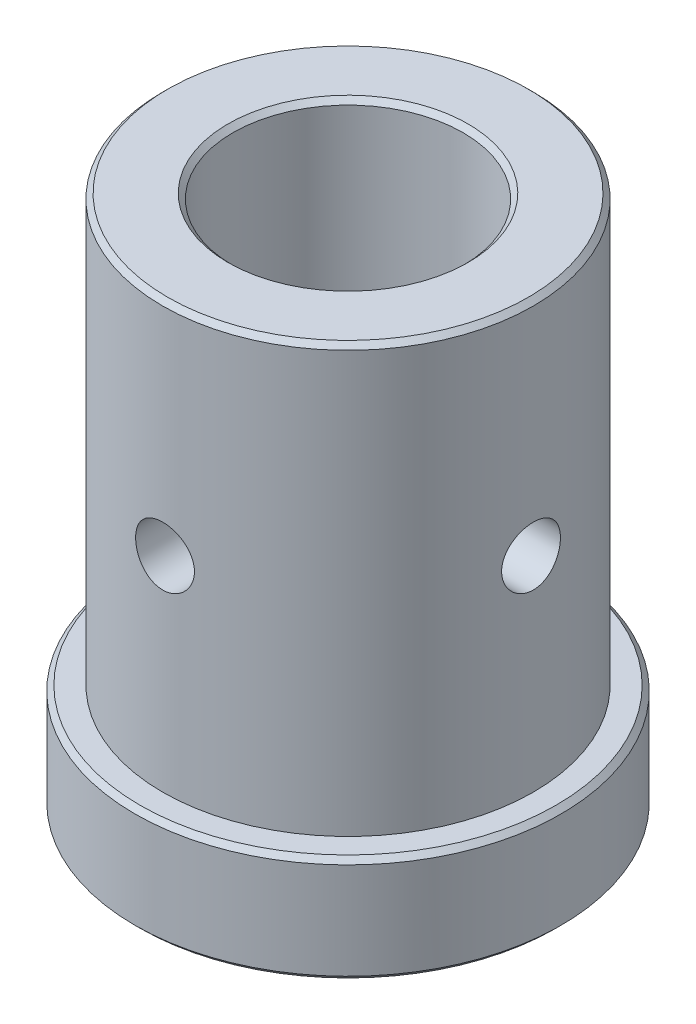
from build123d import *

# Parameters (mm, degrees)
SKETCH1_R               = 11.049
BOSS_EXTRUDE1_DEPTH     = 25.4
SKETCH2_R               = 12.7
BOSS_EXTRUDE2_DEPTH     = 6.35
SKETCH3_R               = 6.858
CUT_EXTRUDE1_DEPTH      = 37.477972806
CHAMFER1_SIZE           = 0.299999908
CUT_EXTRUDE2_DEPTH      = 32.108519733
CUT_EXTRUDE2_DEPTH_BACK = 32.108519733
SKETCH5_R               = 1.7526
CUT_EXTRUDE3_DEPTH      = 32.108519733
CUT_EXTRUDE3_DEPTH_BACK = 32.108519733
SKETCH6_R               = 1.7526


with BuildPart() as part:
    # Sketch1 → Boss-Extrude1 (new body)
    with BuildSketch(Plane(origin=(0, 0, 0), x_dir=(1, 0, 0), z_dir=(0, 1, 0))):
        Circle(SKETCH1_R)
    extrude(amount=BOSS_EXTRUDE1_DEPTH)

    # Sketch2 → Boss-Extrude2 (add)
    with BuildSketch(Plane.XZ):
        Circle(SKETCH2_R)
    extrude(amount=BOSS_EXTRUDE2_DEPTH)

    # Sketch3 → Cut-Extrude1 (cut, through all)
    with BuildSketch(Plane.XZ.offset(6.35)):
        Circle(SKETCH3_R)
    extrude(amount=-CUT_EXTRUDE1_DEPTH, mode=Mode.SUBTRACT)

    # Chamfer1
    chamfer1_edges = [part.edges().sort_by_distance(p)[0] for p in [
        (-12.7, 0, 0),
        (-12.7, -6.35, 0),
        (-11.049, 25.4, 0),
        (-6.858, 25.4, 0),
        (-6.858, -6.35, 0),
    ]]
    chamfer(chamfer1_edges, length=CHAMFER1_SIZE)

    # Sketch5 → Cut-Extrude2 (cut, two sides: drawn at the far end of the back side and taken through both)
    with BuildSketch(Plane.XY.offset(-CUT_EXTRUDE2_DEPTH_BACK)):
        with Locations((0, 12.192)):
            Circle(SKETCH5_R)
    extrude(amount=CUT_EXTRUDE2_DEPTH + CUT_EXTRUDE2_DEPTH_BACK, mode=Mode.SUBTRACT)

    # Sketch6 → Cut-Extrude3 (cut, two sides: drawn at the far end of the back side and taken through both)
    with BuildSketch(Plane(origin=(0, 0, 0), x_dir=(0, 0, -1), z_dir=(1, 0, 0)).offset(-CUT_EXTRUDE3_DEPTH_BACK)):
        with Locations((0, 12.192)):
            Circle(SKETCH6_R)
    extrude(amount=CUT_EXTRUDE3_DEPTH + CUT_EXTRUDE3_DEPTH_BACK, mode=Mode.SUBTRACT)


solid = part.part
